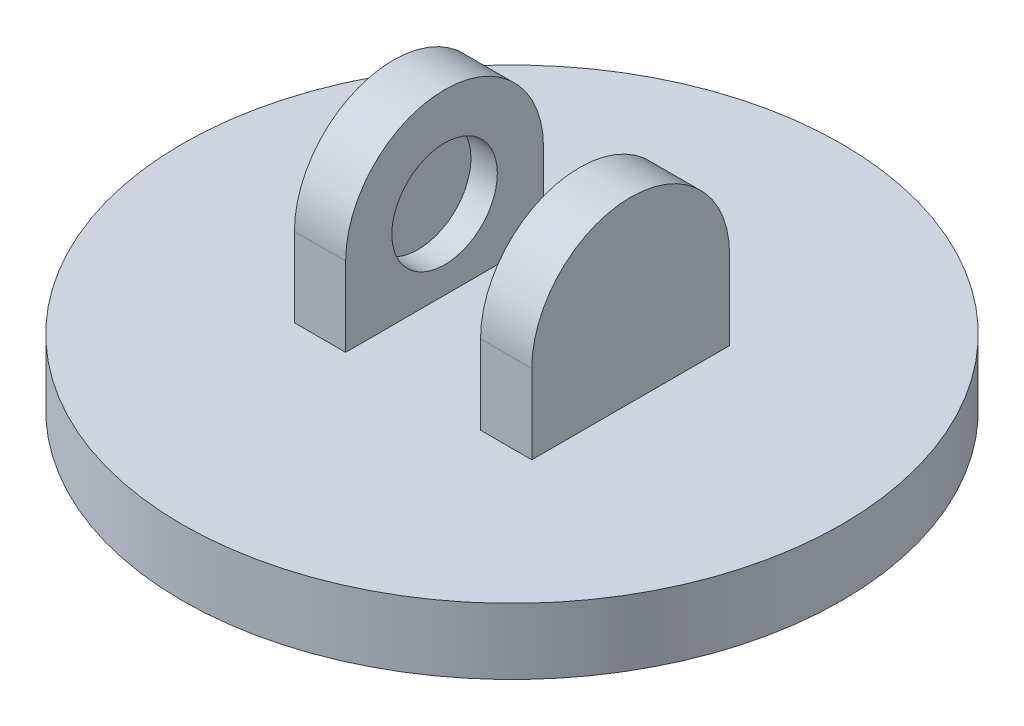
from build123d import *
from OCP.BRepAlgoAPI import BRepAlgoAPI_Cut
from OCP.TopTools import TopTools_ListOfShape

# Parameters (mm, degrees)
SKETCH1_R           = 150
BOSS_EXTRUDE1_DEPTH = 50
SKETCH2_W           = 180
SKETCH2_H           = 150
BOSS_EXTRUDE2_DEPTH = 120
SKETCH4_W           = 150
SKETCH4_H           = 60
CUT_EXTRUDE1_DEPTH  = 180
BOSS_EXTRUDE3_DEPTH = 180
SKETCH5_W           = 102.267162736
SKETCH5_H           = 75
CUT_EXTRUDE3_DEPTH  = 180
CUT_EXTRUDE4_START  = 100
CUT_EXTRUDE4_DEPTH  = 100
CUT_EXTRUDE5_START  = -2.26716
CUT_EXTRUDE5_DEPTH  = 2.26716
SKETCH12_R          = 40
CUT_EXTRUDE6_DEPTH  = 20
CUT_EXTRUDE7_START  = -20
SKETCH11_R          = 40
CUT_EXTRUDE7_DEPTH  = 20
SKETCH15_W          = 102.26716
SKETCH15_H          = 60
CUT_EXTRUDE8_DEPTH  = 408
SKETCH16_R          = 250
BOSS_EXTRUDE4_DEPTH = 50


with BuildPart() as part:
    # Sketch1 → Boss-Extrude1 (new body)
    with BuildSketch(Plane(origin=(0, 0, 0), x_dir=(1, 0, 0), z_dir=(0, 1, 0))):
        Circle(SKETCH1_R)
    extrude(amount=BOSS_EXTRUDE1_DEPTH)

    # Sketch2 → Boss-Extrude2 (add)
    with BuildSketch(Plane(origin=(0, 50, 0), x_dir=(1, 0, 0), z_dir=(0, 1, 0))):
        Rectangle(SKETCH2_W, SKETCH2_H)
    extrude(amount=BOSS_EXTRUDE2_DEPTH)

    # Sketch4 → Cut-Extrude1 (cut)
    with BuildSketch(Plane.ZY.offset(90)):
        with Locations((0, 140)):
            Rectangle(SKETCH4_W, SKETCH4_H)
    extrude(amount=-CUT_EXTRUDE1_DEPTH, mode=Mode.SUBTRACT)

    # Sketch3 → Boss-Extrude3 (add)
    with BuildSketch(Plane(origin=(90, 0, 0), x_dir=(0, 0, -1), z_dir=(1, 0, 0))):
        with BuildLine():
            Line((-75, 110), (-75, 50))
            Line((-75, 50), (75, 50))
            Line((75, 50), (75, 110))
            ThreePointArc((75, 110), (0, 185), (-75, 110))
        make_face()
    extrude(amount=-BOSS_EXTRUDE3_DEPTH)

    # Sketch5 → Cut-Extrude3 (cut)
    with BuildSketch(Plane.XY.offset(75)):
        with Locations((0, 147.5)):
            Rectangle(SKETCH5_W, SKETCH5_H)
    extrude(amount=-CUT_EXTRUDE3_DEPTH, mode=Mode.SUBTRACT)

    # Sketch8 → Cut-Extrude4 (cut)
    with BuildSketch(Plane(origin=(-51.133581368, 0, 0), x_dir=(0, 0, -1), z_dir=(1, 0, 0)).offset(CUT_EXTRUDE4_START)):
        with BuildLine():
            Line((-75, 110), (75, 110))
            ThreePointArc((75, 110), (0, 35), (-75, 110))
        make_face()
    extrude(amount=-CUT_EXTRUDE4_DEPTH, mode=Mode.SUBTRACT)

    # Sketch10 → Cut-Extrude5 (cut)
    with BuildSketch(Plane.ZY.offset(-48.866418632).offset(CUT_EXTRUDE5_START)):
        with BuildLine():
            Line((-75, 110), (75, 110))
            ThreePointArc((75, 110), (0, 35), (-75, 110))
        make_face()
    extrude(amount=CUT_EXTRUDE5_DEPTH, mode=Mode.SUBTRACT)


with BuildPart() as cut_extrude6_tool:
    # Sketch12 → Cut-Extrude6 (new body)
    with BuildSketch(Plane.ZY.offset(-51.133581368)):
        with Locations((0, 110)):
            Circle(SKETCH12_R)
    extrude(amount=-CUT_EXTRUDE6_DEPTH)


with BuildPart() as part_1:
    add(part.part)

    # Cut-Extrude6: cut by cut_extrude6_tool, with a tolerance
    cut_extrude6_stock = TopTools_ListOfShape()
    cut_extrude6_stock.Append(part_1.part.wrapped)
    cut_extrude6_tools = TopTools_ListOfShape()
    cut_extrude6_tools.Append(cut_extrude6_tool.part.wrapped)
    cut_extrude6_cut = BRepAlgoAPI_Cut()
    cut_extrude6_cut.SetArguments(cut_extrude6_stock)
    cut_extrude6_cut.SetTools(cut_extrude6_tools)
    cut_extrude6_cut.SetFuzzyValue(0.00001)
    cut_extrude6_cut.Build()
    add(Compound.cast(cut_extrude6_cut.Shape()).solids(), mode=Mode.REPLACE)

    # Sketch11 → Cut-Extrude7 (cut)
    with BuildSketch(Plane(origin=(-51.133581368, 0, 0), x_dir=(0, 0, -1), z_dir=(1, 0, 0)).offset(CUT_EXTRUDE7_START)):
        with Locations((0, 110)):
            Circle(SKETCH11_R)
    extrude(amount=CUT_EXTRUDE7_DEPTH, mode=Mode.SUBTRACT)

    # Sketch15 → Cut-Extrude8 (cut)
    with BuildSketch(Plane.XY.offset(75)):
        with Locations((-1.368e-06, 80)):
            Rectangle(SKETCH15_W, SKETCH15_H)
    extrude(amount=-CUT_EXTRUDE8_DEPTH, mode=Mode.SUBTRACT)

    # Sketch16 → Boss-Extrude4 (add)
    with BuildSketch(Plane.XZ):
        Circle(SKETCH16_R)
    extrude(amount=-BOSS_EXTRUDE4_DEPTH)


solid = part_1.part
